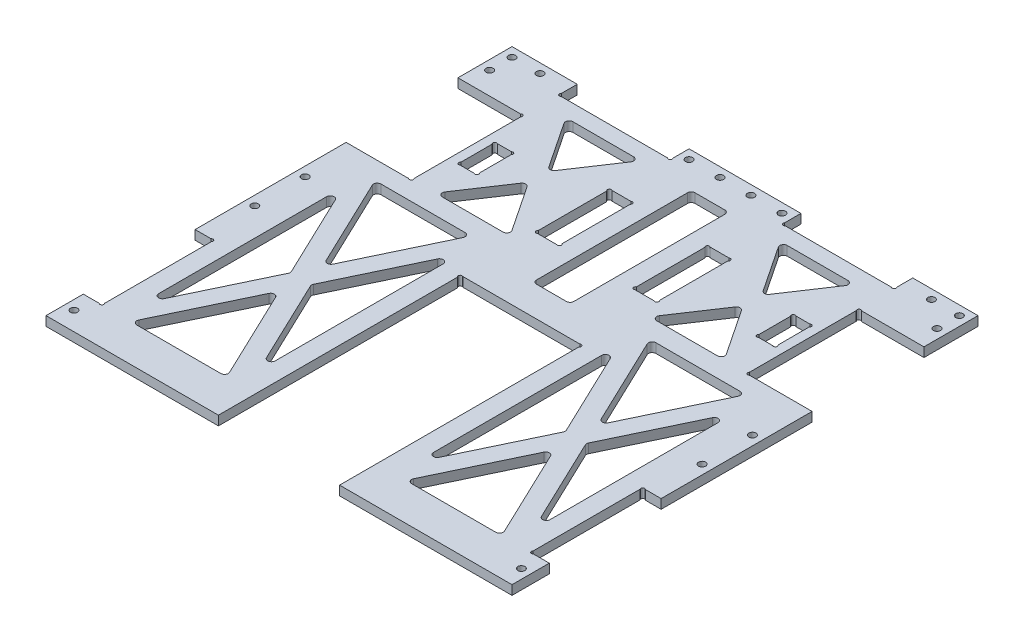
from build123d import *

# Parameters (mm, degrees)
BOSS_EXTRUDE1_DEPTH = 6.35
SKETCH2_W           = 44.45
SKETCH2_H           = 76.2
SKETCH2_W_2         = 12.7
SKETCH2_W_3         = 76.2
SKETCH2_H_2         = 12.7
CUT_EXTRUDE1_DEPTH  = 289.907554418
CUT_EXTRUDE3_DEPTH  = 289.907554418
SKETCH3_W           = 15.875
SKETCH3_H           = 50.8
SKETCH3_W_2         = 12.7
SKETCH3_H_2         = 25.4
CUT_EXTRUDE2_DEPTH  = 289.907554418
SKETCH7_R           = 2.413
CUT_EXTRUDE6_DEPTH  = 289.907554418
SKETCH10_R          = 1.27
CUT_EXTRUDE7_DEPTH  = 289.907554418
SKETCH12_W          = 25.4
SKETCH12_H          = 107.95
CUT_EXTRUDE9_DEPTH  = 289.907554418
FILLET1_R           = 2.54
FILLET2_R           = 2.54


with BuildPart() as part:
    # Sketch1 → Boss-Extrude1 (new body)
    with BuildSketch(Plane(origin=(0, 0, 0), x_dir=(1, 0, 0), z_dir=(0, 1, 0))):
        Polygon((-158.75, 76.2), (-158.75, -241.3), (-41.275, -241.3), (-41.275, -76.2), (41.275, -76.2), (41.275, -241.3), (158.75, -241.3), (158.75, 76.2), align=None)
    extrude(amount=BOSS_EXTRUDE1_DEPTH)

    # Sketch2 → Cut-Extrude1 (cut, through all)
    with BuildSketch(Plane(origin=(0, 6.35, 0), x_dir=(1, 0, 0), z_dir=(0, 1, 0))):
        with Locations((136.525, 1.27)):
            Rectangle(SKETCH2_W, SKETCH2_H)
        with Locations((152.4, -177.8)):
            Rectangle(SKETCH2_W_2, SKETCH2_H)
        with Locations((-152.4, -177.8)):
            Rectangle(SKETCH2_W_2, SKETCH2_H)
        with Locations((-136.525, 1.27)):
            Rectangle(SKETCH2_W, SKETCH2_H)
        with Locations((-76.2, 69.85)):
            Rectangle(SKETCH2_W_3, SKETCH2_H_2)
        with Locations((76.2, 69.85)):
            Rectangle(SKETCH2_W_3, SKETCH2_H_2)
    extrude(amount=-CUT_EXTRUDE1_DEPTH, mode=Mode.SUBTRACT)

    # Sketch4 → Cut-Extrude3 (cut, through all)
    with BuildSketch(Plane(origin=(0, 6.35, 0), x_dir=(1, 0, 0), z_dir=(0, 1, 0))):
        Polygon((93.6625, -147.46179464), (61.010684466, -215.9), (126.314315534, -215.9), align=None)
        Polygon((53.975, -64.27679464), (53.975, -201.15320536), (86.626815534, -132.715), align=None)
        Polygon((133.35, -64.27679464), (100.698184466, -132.715), (133.35, -201.15320536), align=None)
        Polygon((61.010684466, -49.53), (93.6625, -117.96820536), (126.314315534, -49.53), align=None)
        Polygon((-86.626815534, -132.715), (-53.975, -201.15320536), (-53.975, -64.27679464), align=None)
        Polygon((-126.314315534, -49.53), (-93.6625, -117.96820536), (-61.010684466, -49.53), align=None)
        Polygon((-61.010684466, -215.9), (-93.6625, -147.46179464), (-126.314315534, -215.9), align=None)
        Polygon((-133.35, -201.15320536), (-100.698184466, -132.715), (-133.35, -64.27679464), align=None)
    extrude(amount=-CUT_EXTRUDE3_DEPTH, mode=Mode.SUBTRACT)

    # Sketch3 → Cut-Extrude2 (cut, through all)
    with BuildSketch(Plane(origin=(0, 6.35, 0), x_dir=(1, 0, 0), z_dir=(0, 1, 0))):
        with Locations((-33.3375, 0)):
            Rectangle(SKETCH3_W, SKETCH3_H)
        with Locations((33.3375, 0)):
            Rectangle(SKETCH3_W, SKETCH3_H)
        with Locations((101.6, 1.27)):
            Rectangle(SKETCH3_W_2, SKETCH3_H_2)
        with Locations((-101.6, 1.27)):
            Rectangle(SKETCH3_W_2, SKETCH3_H_2)
    extrude(amount=-CUT_EXTRUDE2_DEPTH, mode=Mode.SUBTRACT)

    # Sketch7 → Cut-Extrude6 (cut, through all)
    with BuildSketch(Plane(origin=(0, 6.35, 0), x_dir=(1, 0, 0), z_dir=(0, 1, 0))):
        with Locations((152.4, -105.41)):
            Circle(SKETCH7_R)
        with Locations((152.4, -71.12)):
            Circle(SKETCH7_R)
        with Locations((152.4, -228.6)):
            Circle(SKETCH7_R)
        with Locations((152.4, 69.85)):
            Circle(SKETCH7_R)
        with Locations((133.35, 69.85)):
            Circle(SKETCH7_R)
        with Locations((152.4, 54.61)):
            Circle(SKETCH7_R)
        with Locations((-152.4, -228.6)):
            Circle(SKETCH7_R)
        with Locations((-31.75, 69.85)):
            Circle(SKETCH7_R)
        with Locations((-10.668, 69.85)):
            Circle(SKETCH7_R)
        with Locations((10.414, 69.85)):
            Circle(SKETCH7_R)
        with Locations((31.496, 69.85)):
            Circle(SKETCH7_R)
        with Locations((-152.4, 54.61)):
            Circle(SKETCH7_R)
        with Locations((-133.35, 69.85)):
            Circle(SKETCH7_R)
        with Locations((-152.4, 69.85)):
            Circle(SKETCH7_R)
        with Locations((-152.4, -71.12)):
            Circle(SKETCH7_R)
        with Locations((-152.4, -105.41)):
            Circle(SKETCH7_R)
    extrude(amount=-CUT_EXTRUDE6_DEPTH, mode=Mode.SUBTRACT)

    # Sketch10 → Cut-Extrude7 (cut, through all)
    with BuildSketch(Plane(origin=(0, 6.35, 0), x_dir=(1, 0, 0), z_dir=(0, 1, 0))):
        with Locations((-146.972777351, -215.027427963)):
            Circle(SKETCH10_R)
        with Locations((-147.028600744, -140.509469322)):
            Circle(SKETCH10_R)
        with Locations((-115.209517005, -35.943614747)):
            Circle(SKETCH10_R)
        with Locations((-115.253299238, 38.530881079)):
            Circle(SKETCH10_R)
        with Locations((-113.422071626, 64.417682826)):
            Circle(SKETCH10_R)
        with Locations((-39.079710289, 64.308126073)):
            Circle(SKETCH10_R)
        with Locations((-107.193508458, 12.949891895)):
            Circle(SKETCH10_R)
        with Locations((-96.092799657, 13.019953297)):
            Circle(SKETCH10_R)
        with Locations((-107.232715406, -10.381952858)):
            Circle(SKETCH10_R)
        with Locations((-96.02881134, -10.426828581)):
            Circle(SKETCH10_R)
        with Locations((-40.581129145, 24.336306794)):
            Circle(SKETCH10_R)
        with Locations((-26.218352303, 24.428815409)):
            Circle(SKETCH10_R)
        with Locations((-40.523647956, -24.376100539)):
            Circle(SKETCH10_R)
        with Locations((-25.995686631, -24.278368404)):
            Circle(SKETCH10_R)
        with Locations((-40.57220406, -77.257817502)):
            Circle(SKETCH10_R)
        with Locations((40.57220406, -77.257817502)):
            Circle(SKETCH10_R)
        with Locations((25.995686631, -24.278368404)):
            Circle(SKETCH10_R)
        with Locations((40.523647956, -24.376100539)):
            Circle(SKETCH10_R)
        with Locations((26.218352303, 24.428815409)):
            Circle(SKETCH10_R)
        with Locations((40.581129145, 24.336306794)):
            Circle(SKETCH10_R)
        with Locations((96.02881134, -10.426828581)):
            Circle(SKETCH10_R)
        with Locations((107.232715406, -10.381952858)):
            Circle(SKETCH10_R)
        with Locations((96.092799657, 13.019953297)):
            Circle(SKETCH10_R)
        with Locations((107.193508458, 12.949891895)):
            Circle(SKETCH10_R)
        with Locations((39.079710289, 64.308126073)):
            Circle(SKETCH10_R)
        with Locations((113.422071626, 64.417682826)):
            Circle(SKETCH10_R)
        with Locations((115.253299238, 38.530881079)):
            Circle(SKETCH10_R)
        with Locations((115.209517005, -35.943614747)):
            Circle(SKETCH10_R)
        with Locations((147.028600744, -140.509469322)):
            Circle(SKETCH10_R)
        with Locations((146.972777351, -215.027427963)):
            Circle(SKETCH10_R)
    extrude(amount=-CUT_EXTRUDE7_DEPTH, mode=Mode.SUBTRACT)

    # Sketch12 → Cut-Extrude9 (cut, through all)
    with BuildSketch(Plane(origin=(0, 6.35, 0), x_dir=(1, 0, 0), z_dir=(0, 1, 0))):
        Polygon((-98.425, 52.614228607), (-47.625, 52.614228607), (-73.025, 14.514228607), align=None)
        Polygon((-47.625, -36.285771393), (-73.025, 1.814228607), (-98.425, -36.285771393), align=None)
        Polygon((73.025, 1.814228607), (98.425, -36.285771393), (47.625, -36.285771393), align=None)
        Polygon((73.025, 14.514228607), (98.425, 52.614228607), (47.625, 52.614228607), align=None)
        with Locations((0, -1.679180184)):
            Rectangle(SKETCH12_W, SKETCH12_H)
    extrude(amount=-CUT_EXTRUDE9_DEPTH, mode=Mode.SUBTRACT)

    # Fillet1
    fillet1_edges = [part.edges().sort_by_distance(p)[0] for p in [
        (-12.7, 3.175, 55.654180184),
        (-12.7, 3.175, -52.295819816),
        (-133.35, 3.175, 64.27679464),
        (-133.35, 3.175, 201.15320536),
        (-126.314315534, 3.175, 215.9),
        (-61.010684466, 3.175, 215.9),
        (-93.6625, 3.175, 147.46179464),
        (-86.626815534, 3.175, 132.715),
        (-53.975, 3.175, 64.27679464),
        (-53.975, 3.175, 201.15320536),
        (-93.6625, 3.175, 117.96820536),
        (-100.698184466, 3.175, 132.715),
        (-61.010684466, 3.175, 49.53),
        (-126.314315534, 3.175, 49.53),
        (-98.425, 3.175, 36.285771393),
        (-47.625, 3.175, 36.285771393),
        (-73.025, 3.175, -1.814228607),
        (-73.025, 3.175, -14.514228607),
        (-47.625, 3.175, -52.614228607),
        (-98.425, 3.175, -52.614228607),
    ]]
    fillet(fillet1_edges, radius=FILLET1_R)

    # Fillet2
    fillet2_edges = [part.edges().sort_by_distance(p)[0] for p in [
        (53.975, 3.175, 64.27679464),
        (133.35, 3.175, 64.27679464),
        (93.6625, 3.175, 147.46179464),
        (100.698184466, 3.175, 132.715),
        (53.975, 3.175, 201.15320536),
        (61.010684466, 3.175, 215.9),
        (133.35, 3.175, 201.15320536),
        (86.626815534, 3.175, 132.715),
        (126.314315534, 3.175, 215.9),
        (93.6625, 3.175, 117.96820536),
        (61.010684466, 3.175, 49.53),
        (126.314315534, 3.175, 49.53),
        (73.025, 3.175, -1.814228607),
        (47.625, 3.175, 36.285771393),
        (98.425, 3.175, 36.285771393),
        (98.425, 3.175, -52.614228607),
        (73.025, 3.175, -14.514228607),
        (12.7, 3.175, 55.654180184),
        (12.7, 3.175, -52.295819816),
        (47.625, 3.175, -52.614228607),
    ]]
    fillet(fillet2_edges, radius=FILLET2_R)


solid = part.part
